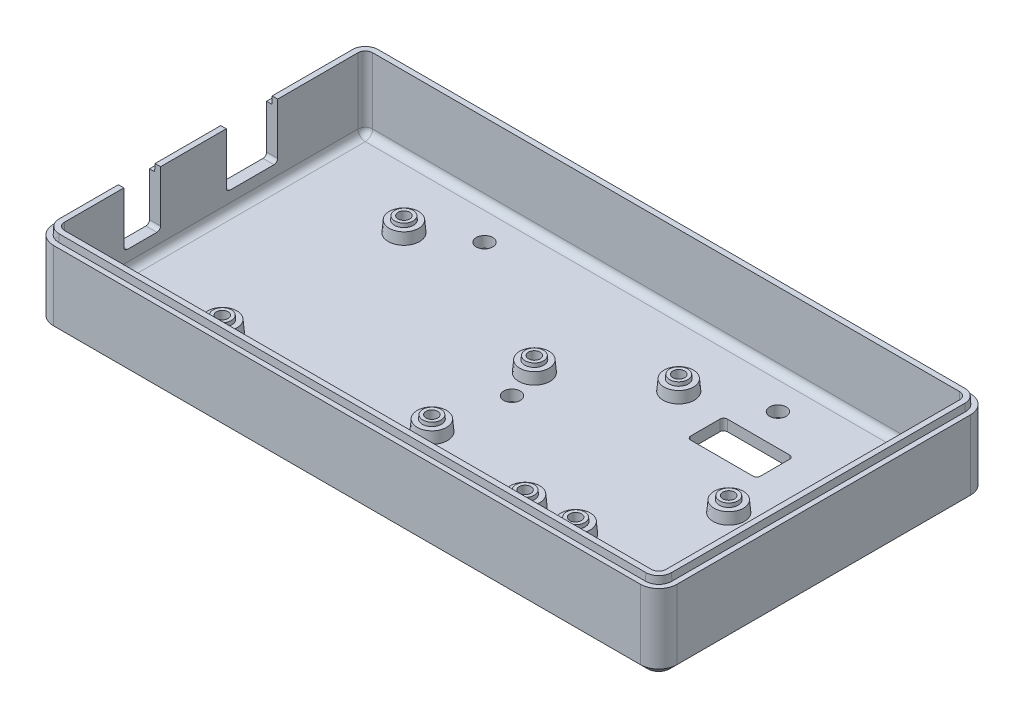
from build123d import *

# Parameters (mm, degrees)
CROQUIS2_W                         = 170
CROQUIS2_H                         = 90
SALIENTE_EXTRUIR1_DEPTH            = 23
REDONDEO1_R                        = 5
VACIADO1_T                         = -3
REDONDEO4_R                        = 2
CHAFL_N1_SIZE                      = 2
CORTAR_EXTRUIR1_REACH              = 179.353
CROQUIS3_W                         = 14
CROQUIS3_H                         = 19.902430744
CROQUIS3_W_2                       = 10
CROQUIS3_H_2                       = 25.118860909
REDONDEO2_R                        = 1
CROQUIS4_W                         = 18.994013978
CROQUIS4_H                         = 9.979905649
CORTAR_EXTRUIR2_DEPTH              = 99.234413522
REDONDEO3_R                        = 1
SELECCIONAR_OPERACIONES1_OUTLINE_W = 1.395184441
SELECCIONAR_OPERACIONES1_OUTLINE_H = 17.925
SELECCIONAR_OPERACIONES1_DEPTH     = 2
SELECCIONAR_OPERACIONES1_DRAFT     = -3
SELECCIONAR_OPERACIONES1_2_DEPTH   = 2
SELECCIONAR_OPERACIONES1_2_DRAFT   = -3
TALADRO_DE_MARGEN_PARA_M41_D       = 4.5


# Read off the part's stored shape, not the designer's step: Saliente de montaje5, Seleccionar operaciones1
with BuildPart() as part:
    # Croquis2 → Saliente-Extruir1 (new body)
    with BuildSketch(Plane(origin=(0, 0, 0), x_dir=(1, 0, 0), z_dir=(0, 1, 0))):
        Rectangle(CROQUIS2_W, CROQUIS2_H)
    extrude(amount=SALIENTE_EXTRUIR1_DEPTH)

    # Redondeo1
    redondeo1_edges = [part.edges().sort_by_distance(p)[0] for p in [
        (85, 11.5, 45),
        (-85, 11.5, 45),
        (-85, 11.5, -45),
        (85, 11.5, -45),
    ]]
    fillet(redondeo1_edges, radius=REDONDEO1_R)

    # Vaciado1
    vaciado1_openings = [part.faces().sort_by_distance(p)[0] for p in [
        (0, 23, 0),
    ]]
    offset(amount=VACIADO1_T, openings=vaciado1_openings, kind=Kind.INTERSECTION)

    # Redondeo4
    redondeo4_edges = [part.edges().sort_by_distance(p)[0] for p in [
        (82, 3, 0),
        (0, 3, -42),
        (-82, 3, 0),
        (0, 3, 42),
        (81.414213562, 3, 41.414213562),
        (-81.414213562, 3, 41.414213562),
        (-81.414213562, 3, -41.414213562),
        (81.414213562, 3, -41.414213562),
    ]]
    fillet(redondeo4_edges, radius=REDONDEO4_R)

    # Chaflán1
    chafl_n1_edges = [part.edges().sort_by_distance(p)[0] for p in [
        (85, 0, 0),
        (0, 0, 45),
        (-85, 0, 0),
        (0, 0, -45),
        (-83.535533906, 0, 43.535533906),
        (-83.535533906, 0, -43.535533906),
        (83.535533906, 0, -43.535533906),
        (83.535533906, 0, 43.535533906),
    ]]
    chamfer(chafl_n1_edges, length=CHAFL_N1_SIZE)

    # Saliente de montaje5 outline → Saliente de montaje5 (revolve, cut)
    with BuildSketch(Plane(origin=(-54.53, 0, 24.462759338), x_dir=(1, 0, 0), z_dir=(0, 0, 1))):
        Polygon((2.128547792, 0), (2.076182597, 3), (0, 3), (0, 0), align=None)
    saliente_de_montaje5 = revolve(axis=Axis((-54.53, 0, 24.462759338), (0, 1, 0)), mode=Mode.SUBTRACT)

    # Saliente de montaje5 2 outline → Saliente de montaje5 2 (revolve)
    with BuildSketch(Plane(origin=(-54.53, 0, 24.462759338), x_dir=(1, 0, 0), z_dir=(0, 0, 1))):
        Polygon((4, 6), (2.587488664, 6), (2.5, 7), (1.6, 7), (1.6, 4.5), (2.05, 4.5), (2.076182597, 3), (4.262465991, 3), align=None)
    saliente_de_montaje5_2 = revolve(axis=Axis((-54.53, 0, 24.462759338), (0, 1, 0)))

    # Matriz de croquis1: Saliente de montaje5, Saliente de montaje5 2 at 8 more places
    with Locations((1.27, 0, -48.26), (52.07, 0, -33.02), (52.07, 0, -5.08), (82.55, 0, 0), (76.2, 0, -48.26), (111.63, 0, -26.46), (95.88, 0, -0.46), (127.38, 0, -0.46)):
        add(saliente_de_montaje5, mode=Mode.SUBTRACT)
        add(saliente_de_montaje5_2)

    # Croquis3 → Cortar-Extruir1 (cut, up to next)
    with BuildSketch(Plane.ZY.offset(85), mode=Mode.PRIVATE) as cortar_extruir1_sk1:
        with Locations((-11.097240662, 17.951215372)):
            Rectangle(CROQUIS3_W, CROQUIS3_H)
    cortar_extruir1_tool1 = extrude(cortar_extruir1_sk1.sketch, amount=-CORTAR_EXTRUIR1_REACH, mode=Mode.PRIVATE) & part.part
    # Croquis3 → Cortar-Extruir1 (cut, up to next)
    with BuildSketch(Plane.ZY.offset(85), mode=Mode.PRIVATE) as cortar_extruir1_sk2:
        with Locations((18.827759338, 20.559430454)):
            Rectangle(CROQUIS3_W_2, CROQUIS3_H_2)
    cortar_extruir1_tool2 = extrude(cortar_extruir1_sk2.sketch, amount=-CORTAR_EXTRUIR1_REACH, mode=Mode.PRIVATE) & part.part
    add(cortar_extruir1_tool1.solids().sort_by_distance((-85, 17.951215, -11.097241))[0], mode=Mode.SUBTRACT)
    add(cortar_extruir1_tool2.solids().sort_by_distance((-85, 20.55943, 18.827759))[0], mode=Mode.SUBTRACT)

    # Redondeo2
    redondeo2_edges = [part.edges().sort_by_distance(p)[0] for p in [
        (-83.5, 8, -4.097240662),
        (-83.5, 8, -18.097240662),
        (-83.5, 8, 23.827759338),
        (-83.5, 8, 13.827759338),
    ]]
    fillet(redondeo2_edges, radius=REDONDEO2_R)

    # Croquis4 → Cortar-Extruir2 (cut, through all)
    with BuildSketch(Plane(origin=(0, 3, 0), x_dir=(1, 0, 0), z_dir=(0, 1, 0))):
        with Locations((43.352971059, 18.87114604)):
            Rectangle(CROQUIS4_W, CROQUIS4_H)
    extrude(amount=-CORTAR_EXTRUIR2_DEPTH, mode=Mode.SUBTRACT)

    # Redondeo3
    redondeo3_edges = [part.edges().sort_by_distance(p)[0] for p in [
        (52.849978048, 1.5, -23.861098864),
        (52.849978048, 1.5, -13.881193215),
        (33.85596407, 1.5, -13.881193215),
        (33.85596407, 1.5, -23.861098864),
    ]]
    fillet(redondeo3_edges, radius=REDONDEO3_R)


with BuildPart() as seleccionar_operaciones1_tool:
    # Seleccionar operaciones1 outline → Seleccionar operaciones1 (with draft: the straight prism first)
    with BuildSketch(Plane(origin=(0, 21, 0), x_dir=(1, 0, 0), z_dir=(0, 1, 0))):
        with Locations((-84.30240778, -4.865259338)):
            Rectangle(SELECCIONAR_OPERACIONES1_OUTLINE_W, SELECCIONAR_OPERACIONES1_OUTLINE_H)
    extrude(amount=SELECCIONAR_OPERACIONES1_DEPTH)
    # Seleccionar operaciones1: the draft: its side faces are tilted about the plane it starts from
    seleccionar_operaciones1_sides = [seleccionar_operaciones1_tool.faces().sort_by_distance(p)[0] for p in [
        (-84.30240778, 22, 13.827759338),
        (-83.604815559, 22, 4.865259338),
        (-84.30240778, 22, -4.097240662),
        (-85, 22, 4.865259338),
    ]]
    draft(seleccionar_operaciones1_sides, Plane(origin=(0, 21, 0), x_dir=(1, 0, 0), z_dir=(0, 1, 0)), SELECCIONAR_OPERACIONES1_DRAFT)


with BuildPart() as part_1:
    add(part.part)

    # Seleccionar operaciones1: cut by seleccionar_operaciones1_tool
    add(seleccionar_operaciones1_tool.part, mode=Mode.SUBTRACT)


with BuildPart() as seleccionar_operaciones1_2_tool:
    # Seleccionar operaciones1 2 outline → Seleccionar operaciones1 2 (with draft: the straight prism first)
    with BuildSketch(Plane(origin=(0, 21, 0), x_dir=(1, 0, 0), z_dir=(0, 1, 0))):
        with BuildLine():
            Line((-83.604815559, -23.827759338), (-85, -23.827759338))
            Line((-85, -23.827759338), (-85, -40))
            ThreePointArc((-85, -40), (-83.535533906, -43.535533906), (-80, -45))
            Line((-80, -45), (80, -45))
            ThreePointArc((80, -45), (83.535533906, -43.535533906), (85, -40))
            Line((85, -40), (85, 40))
            ThreePointArc((85, 40), (83.535533906, 43.535533906), (80, 45))
            Line((80, 45), (-80, 45))
            ThreePointArc((-80, 45), (-83.535533906, 43.535533906), (-85, 40))
            Line((-85, 40), (-85, 18.097240662))
            Line((-85, 18.097240662), (-83.604815559, 18.097240662))
            Line((-83.604815559, 18.097240662), (-83.604815559, 40))
            ThreePointArc((-83.604815559, 40), (-82.548989526, 42.548989526), (-80, 43.604815559))
            Line((-80, 43.604815559), (80, 43.604815559))
            ThreePointArc((80, 43.604815559), (82.548989526, 42.548989526), (83.604815559, 40))
            Line((83.604815559, 40), (83.604815559, -40))
            ThreePointArc((83.604815559, -40), (82.548989526, -42.548989526), (80, -43.604815559))
            Line((80, -43.604815559), (-80, -43.604815559))
            ThreePointArc((-80, -43.604815559), (-82.548989526, -42.548989526), (-83.604815559, -40))
            Line((-83.604815559, -40), (-83.604815559, -23.827759338))
        make_face()
    extrude(amount=SELECCIONAR_OPERACIONES1_2_DEPTH)
    # Seleccionar operaciones1 2: the draft: its side faces are tilted about the plane it starts from
    seleccionar_operaciones1_2_sides = [seleccionar_operaciones1_2_tool.faces().sort_by_distance(p)[0] for p in [
        (-82.548989526, 22, 42.548989526),
        (-83.604815559, 22, 31.913879669),
        (-84.30240778, 22, 23.827759338),
        (-85, 22, 31.913879669),
        (-83.535533906, 22, 43.535533906),
        (0, 22, 45),
        (83.535533906, 22, 43.535533906),
        (85, 22, 0),
        (83.535533906, 22, -43.535533906),
        (0, 22, -45),
        (-83.535533906, 22, -43.535533906),
        (-85, 22, -29.048620331),
        (-84.30240778, 22, -18.097240662),
        (-83.604815559, 22, -29.048620331),
        (-82.548989526, 22, -42.548989526),
        (0, 22, -43.604815559),
        (82.548989526, 22, -42.548989526),
        (83.604815559, 22, 0),
        (82.548989526, 22, 42.548989526),
        (0, 22, 43.604815559),
    ]]
    draft(seleccionar_operaciones1_2_sides, Plane(origin=(0, 21, 0), x_dir=(1, 0, 0), z_dir=(0, 1, 0)), SELECCIONAR_OPERACIONES1_2_DRAFT)


with BuildPart() as part_2:
    add(part_1.part)

    # Seleccionar operaciones1 2: cut by seleccionar_operaciones1_2_tool
    add(seleccionar_operaciones1_2_tool.part, mode=Mode.SUBTRACT)

    # Taladro de margen para M41 (through all)
    with Locations(Plane(origin=(0, 3, 0), x_dir=(1, 0, 0), z_dir=(0, 1, 0))):
        with Locations((0, 0), (40, -32.5), (-40, 32.5), (-40, -32.5), (40, 32.5)):
            Hole(TALADRO_DE_MARGEN_PARA_M41_D / 2)


solid = part_2.part
